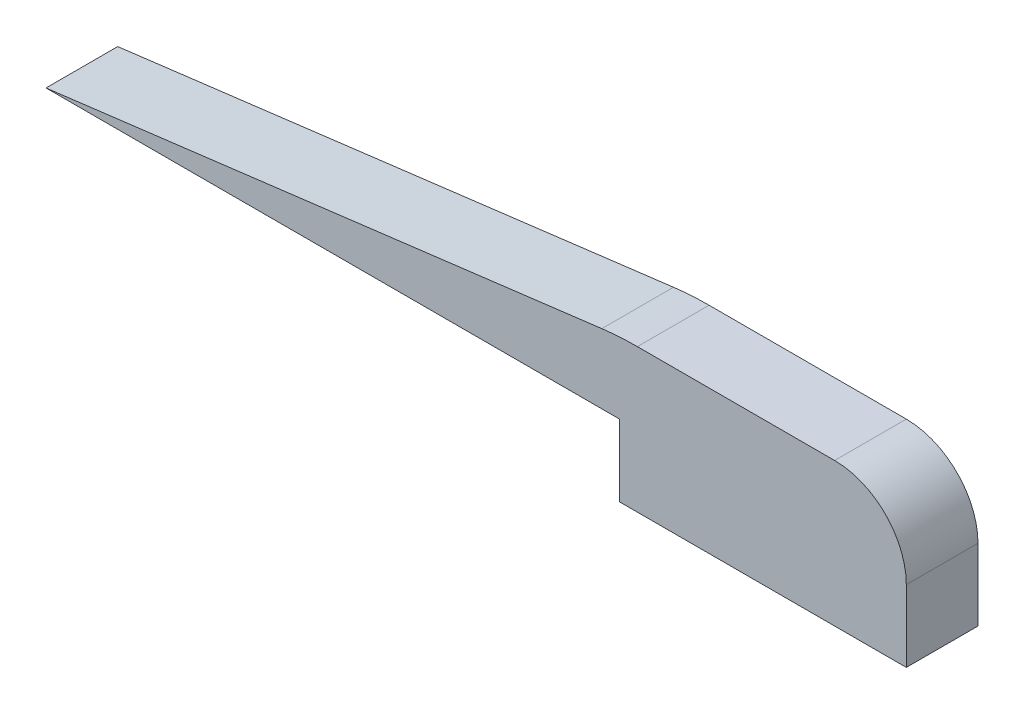
from build123d import *

# Parameters (mm, degrees)
BOSS_EXTRUDE1_DEPTH = 3.175


with BuildPart() as part:
    # Sketch1 → Boss-Extrude1 (new body)
    with BuildSketch(Plane.XY):
        with BuildLine():
            Line((0, 0), (24.615432274, 3.076929034))
            ThreePointArc((24.615432274, 3.076929034), (25.401527896, 3.150458547), (26.190673403, 3.175))
            Line((26.190673403, 3.175), (34.925, 3.175))
            ThreePointArc((34.925, 3.175), (37.17006403, 2.24506403), (38.1, 0))
            Line((38.1, 0), (38.1, -3.175))
            Line((38.1, -3.175), (25.4, -3.175))
            Line((25.4, -3.175), (25.4, 0))
            Line((25.4, 0), (0, 0))
        make_face()
    extrude(amount=BOSS_EXTRUDE1_DEPTH)


solid = part.part
